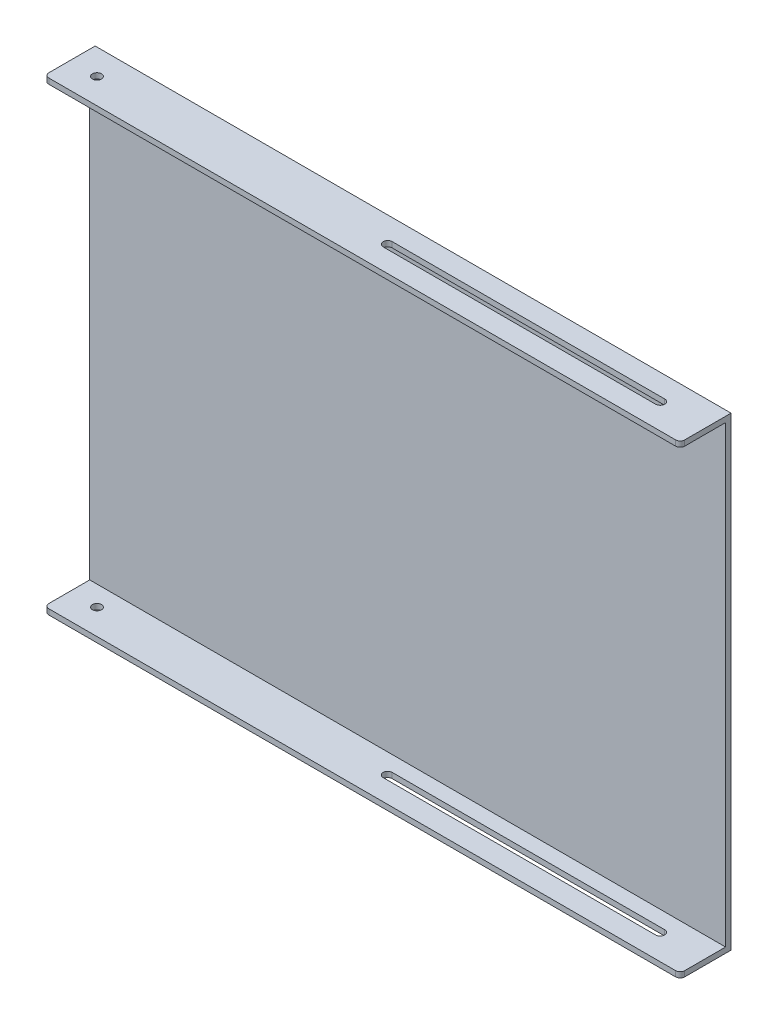
from build123d import *

# Parameters (mm, degrees)
SKETCH4_R               = 5
BOSS_EXTRUDE2_DEPTH     = 256
CUT_EXTRUDE2_DEPTH      = 746.868621139
CUT_EXTRUDE2_DEPTH_BACK = 746.868621139
SKETCH5_W               = 50
SKETCH5_H               = 500


with BuildPart() as part:
    # Sketch4 → Boss-Extrude2 (new, symmetric)
    with BuildSketch(Plane(origin=(0, 0, 0), x_dir=(1, 0, 0), z_dir=(0, 1, 0))):
        with BuildLine():
            Line((-350, 28), (350, 28))
            Line((350, 28), (350, -23))
            ThreePointArc((350, -23), (348.535533906, -26.535533906), (345, -28))
            Line((345, -28), (-345, -28))
            ThreePointArc((-345, -28), (-348.535533906, -26.535533906), (-350, -23))
            Line((-350, -23), (-350, 28))
        make_face()
        with Locations((-320, 0)):
            Circle(SKETCH4_R, mode=Mode.SUBTRACT)
        with BuildLine():
            Line((0, 5), (300, 5))
            ThreePointArc((300, 5), (305, 0), (300, -5))
            Line((300, -5), (0, -5))
            ThreePointArc((0, -5), (-5, 0), (0, 5))
        make_face(mode=Mode.SUBTRACT)
    extrude(amount=BOSS_EXTRUDE2_DEPTH, both=True)

    # Sketch5 → Cut-Extrude2 (cut, two sides: drawn at the far end of the back side and taken through both)
    with BuildSketch(Plane(origin=(350, 0, 0), x_dir=(0, 0, -1), z_dir=(1, 0, 0)).offset(-CUT_EXTRUDE2_DEPTH_BACK)):
        with Locations((-3, 0)):
            Rectangle(SKETCH5_W, SKETCH5_H)
    extrude(amount=CUT_EXTRUDE2_DEPTH + CUT_EXTRUDE2_DEPTH_BACK, mode=Mode.SUBTRACT)


solid = part.part
